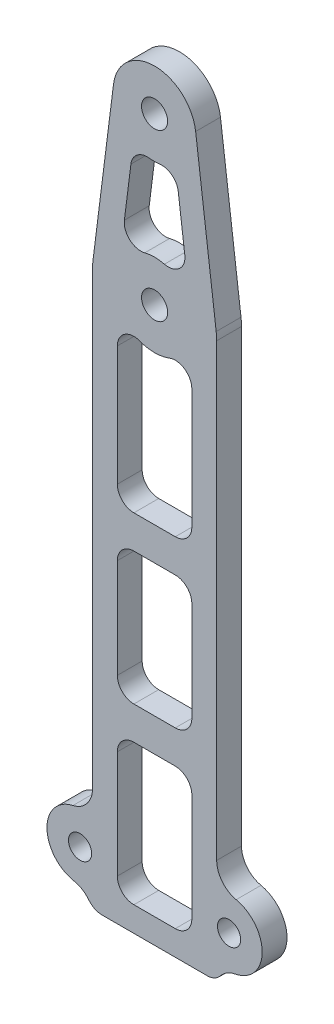
from build123d import *

# Parameters (mm, degrees)
SKETCH_1_R          = 1.575
SKETCH_1_R_2        = 14.5
EXTRUDE_1_DEPTH     = 3
CUT_EXTRUDE_START   = -3
CUT_EXTRUDE_1_DEPTH = 3
SKETCH_3_W          = 9
SKETCH_3_H          = 4
EXTRUDE_2_DEPTH     = 3
SKETCH_4_R          = 4
SKETCH_4_R_2        = 1.4
EXTRUDE_3_DEPTH     = 3
SKETCH_5_W          = 57.078231857
SKETCH_5_H          = 48.607322339
CUT_EXTRUDE_2_DEPTH = 10
SKETCH_6_W          = 9
SKETCH_6_H          = 3
EXTRUDE_4_DEPTH     = 3
FILLET_1_R          = 2
FILLET_2_R          = 3
FILLET_3_R          = 2


with BuildPart() as part:
    # 草图1 → 凸台-拉伸1 (new body)
    with BuildSketch(Plane.XY):
        with BuildLine():
            ThreePointArc((7.5, 0), (7.485279444, 0.469671844), (7.441175562, 0.9375))
            Line((7.441175562, 0.9375), (4.960783708, 20.625))
            ThreePointArc((4.960783708, 20.625), (0, 25), (-4.960783708, 20.625))
            Line((-4.960783708, 20.625), (-7.441175562, 0.9375))
            ThreePointArc((-7.441175562, 0.9375), (-7.485279444, 0.469671844), (-7.5, 0))
            Line((-7.5, 0), (-7.5, -69.31788212))
            ThreePointArc((-7.5, -69.31788212), (0, -112), (7.5, -69.31788212))
            Line((7.5, -69.31788212), (7.5, 0))
        make_face()
        with Locations((-12.374368671, -102.374368671)):
            Circle(SKETCH_1_R, mode=Mode.SUBTRACT)
        with Locations((-12.374368671, -77.625631329)):
            Circle(SKETCH_1_R, mode=Mode.SUBTRACT)
        with Locations((0, -90)):
            Circle(SKETCH_1_R_2, mode=Mode.SUBTRACT)
        with Locations((12.374368671, -102.374368671)):
            Circle(SKETCH_1_R, mode=Mode.SUBTRACT)
        with Locations((12.374368671, -77.625631329)):
            Circle(SKETCH_1_R, mode=Mode.SUBTRACT)
        Circle(SKETCH_1_R, mode=Mode.SUBTRACT)
        with Locations((0, 20)):
            Circle(SKETCH_1_R, mode=Mode.SUBTRACT)
    extrude(amount=EXTRUDE_1_DEPTH)

    # 草图2 → 切除-拉伸1 (cut)
    with BuildSketch(Plane.XY.offset(3).offset(CUT_EXTRUDE_START)):
        with BuildLine():
            Line((0, -68), (0, -5))
            ThreePointArc((0, -5), (-2.655442773, -4.236581603), (-4.5, -2.179449472))
            Line((-4.5, -2.179449472), (-4.5, -68.465144533))
            ThreePointArc((-4.5, -68.465144533), (-2.261988032, -68.116595097), (0, -68))
        make_face()
        with BuildLine():
            ThreePointArc((4.5, -2.179449472), (2.655442773, -4.236581603), (0, -5))
            Line((0, -5), (0, -68))
            ThreePointArc((0, -68), (2.261988032, -68.116595097), (4.5, -68.465144533))
            Line((4.5, -68.465144533), (4.5, -2.179449472))
        make_face()
        with BuildLine():
            Line((-2.557135445, 15.70336663), (-4.192274153, 2.724855487))
            ThreePointArc((-4.192274153, 2.724855487), (0, 5), (4.192274153, 2.724855487))
            Line((4.192274153, 2.724855487), (2.557135445, 15.70336663))
            ThreePointArc((2.557135445, 15.70336663), (0, 15), (-2.557135445, 15.70336663))
        make_face()
    extrude(amount=CUT_EXTRUDE_1_DEPTH, mode=Mode.SUBTRACT)

    # 草图3 → 凸台-拉伸2 (add)
    with BuildSketch(Plane.XY.offset(3)):
        with Locations((0, -45)):
            Rectangle(SKETCH_3_W, SKETCH_3_H)
        with Locations((0, -25)):
            Rectangle(SKETCH_3_W, SKETCH_3_H)
    extrude(amount=-EXTRUDE_2_DEPTH)

    # 草图4 → 凸台-拉伸3 (add)
    # profile 1 of 2: a face of its own
    with BuildSketch(Plane.XY.offset(3)):
        with Locations((-9, -61.2)):
            Circle(SKETCH_4_R)
        with Locations((-9, -61.2)):
            Circle(SKETCH_4_R_2, mode=Mode.SUBTRACT)
    # profile 2 of 2: a face of its own
    with BuildSketch(Plane.XY.offset(3)):
        with Locations((9, -61.2)):
            Circle(SKETCH_4_R)
        with Locations((9, -61.2)):
            Circle(SKETCH_4_R_2, mode=Mode.SUBTRACT)
    extrude(amount=-EXTRUDE_3_DEPTH)

    # 草图5 → 切除-拉伸2 (cut)
    with BuildSketch(Plane.XY.offset(3)):
        with Locations((3.178219729, -91.30366117)):
            Rectangle(SKETCH_5_W, SKETCH_5_H)
    extrude(amount=-CUT_EXTRUDE_2_DEPTH, mode=Mode.SUBTRACT)

    # 草图6 → 凸台-拉伸4 (add)
    with BuildSketch(Plane.XY.offset(3)):
        with Locations((0, -65.5)):
            Rectangle(SKETCH_6_W, SKETCH_6_H)
    extrude(amount=-EXTRUDE_4_DEPTH)

    # 圆角1
    fillet_1_edges = [part.edges().sort_by_distance(p)[0] for p in [
        (-4.5, -27, 1.5),
        (-4.5, -23, 1.5),
        (4.5, -23, 1.5),
        (4.5, -27, 1.5),
        (-2.557135445, 15.70336663, 1.5),
        (2.557135445, 15.70336663, 1.5),
        (4.192274153, 2.724855487, 1.5),
        (-4.192274153, 2.724855487, 1.5),
        (-4.5, -2.179449472, 1.5),
        (4.5, -2.179449472, 1.5),
        (-4.5, -47, 1.5),
        (-4.5, -43, 1.5),
        (4.5, -43, 1.5),
        (4.5, -47, 1.5),
    ]]
    fillet(fillet_1_edges, radius=FILLET_1_R)

    # 圆角2
    # the kernel refuses this fillet: 3 mm, written as the material it adds along each edge
    with BuildSketch(Plane(origin=(-7.5, -64.908099244, 0), x_dir=(0, -1, 0), z_dir=(0, 0, 1))) as fillet_2_piece_1:
        with BuildLine():
            CenterArc((3.170220896, -2.799504541), FILLET_2_R, 111.06581136, 58.235536144)
            Line((0.222369408, -2.242574024), (0.163412378, -2.231435413))
            ThreePointArc((0.163412378, -2.231435413), (0.21267274, -1.11122365), (-0.055621489, -0.0225))
            Line((-0.055621489, -0.0225), (0, 0.06))
            ThreePointArc((0, 0.06), (1.045950378, 0.06), (2.070334354, 0.055990091))
            Line((2.070334354, 0.055990091), (2.091900756, 0))
        make_face()
    extrude(amount=3)
    with BuildSketch(Plane(origin=(-7.5, -57.491900756, 0), x_dir=(0, 1, 0), z_dir=(0, 0, 1))) as fillet_2_piece_2:
        with BuildLine():
            CenterArc((3.129297922, 3), FILLET_2_R, 192.373625116, 77.626374884)
            Line((0.198984851, 2.357142857), (0.14037859, 2.344285714))
            ThreePointArc((0.14037859, 2.344285714), (0.217936404, 1.168572647), (-0.055621489, 0.0225))
            Line((-0.055621489, 0.0225), (0, -0.06))
            Line((0, -0.06), (3.129297922, -0.06))
            Line((3.129297922, -0.06), (3.129297922, 0))
        make_face()
    extrude(amount=3)
    with BuildSketch(Plane(origin=(7.5, -64.908099244, 0), x_dir=(0, -1, 0), z_dir=(0, 0, 1))) as fillet_2_piece_3:
        with BuildLine():
            CenterArc((3.170220896, 2.799504541), FILLET_2_R, 190.698652496, 58.235536144)
            Line((0.222369408, 2.242574024), (0.163412378, 2.231435413))
            ThreePointArc((0.163412378, 2.231435413), (0.21267274, 1.11122365), (-0.055621489, 0.0225))
            Line((-0.055621489, 0.0225), (0, -0.06))
            ThreePointArc((0, -0.06), (1.045950378, -0.06), (2.070334354, -0.055990091))
            Line((2.070334354, -0.055990091), (2.091900756, 0))
        make_face()
    extrude(amount=3)
    with BuildSketch(Plane(origin=(7.5, -57.491900756, 0), x_dir=(0.996455748224994, 0.08411861761445558, 0), z_dir=(0, 0, 1))) as fillet_2_piece_4:
        with BuildLine():
            CenterArc((3.25259946, 2.865851049), FILLET_2_R, 175.17465614, 77.626374884)
            Line((0.263232215, 3.118206902), (0.20344487, 3.123254019))
            Line((0.20344487, 3.123254019), (-0.059787345, 0.005047117))
            Line((-0.059787345, 0.005047117), (0.017741452, -0.057317021))
            ThreePointArc((0.017741452, -0.057317021), (1.18276344, 0.118865267), (2.347785428, -0.057317021))
            Line((2.347785428, -0.057317021), (2.36552688, 0))
        make_face()
    extrude(amount=3)

    # 圆角3
    fillet_3_edges = [part.edges().sort_by_distance(p)[0] for p in [
        (-7.5, -67, 1.5),
        (7.5, -67, 1.5),
        (-4.5, -64, 1.5),
        (4.5, -64, 1.5),
    ]]
    fillet(fillet_3_edges, radius=FILLET_3_R)


solid = part.part
